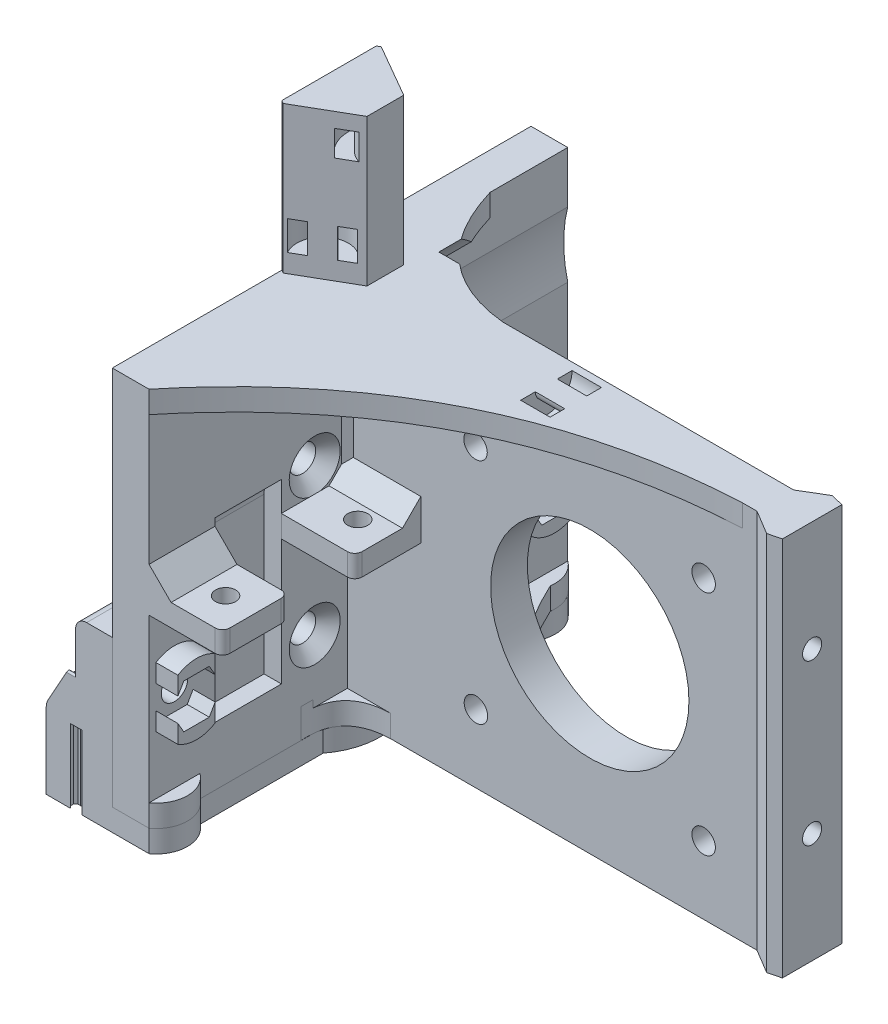
from build123d import *

# Parameters (mm, degrees)
CROQUIS1_W                                           = 41.764356623
CROQUIS1_H                                           = 43.764356531
CROQUIS1_R                                           = 13.5
CROQUIS1_R_2                                         = 1.6
SALIENTE_EXTRUIR1_DEPTH                              = 5
CROQUIS2_W                                           = 5
CROQUIS2_H                                           = 43.764356531
SALIENTE_EXTRUIR2_DEPTH                              = 17
CROQUIS3_W                                           = 5
CROQUIS3_H                                           = 43.764356531
SALIENTE_EXTRUIR3_DEPTH                              = 27
CROQUIS4_W                                           = 5
CROQUIS4_H                                           = 43.764356531
SALIENTE_EXTRUIR4_DEPTH                              = 25
SALIENTE_EXTRUIR5_DEPTH                              = 15.4
SALIENTE_EXTRUIR6_DEPTH                              = 1
SALIENTE_EXTRUIR7_START                              = 1
SALIENTE_EXTRUIR7_DEPTH                              = 3
CROQUIS6_R                                           = 1.6
CORTAR_EXTRUIR1_DEPTH                                = 8
CHAFL_N8_SIZE                                        = 1.5
AVELLANADO_PARA_TORNILLO_CON_CABEZA_AVEL_D           = 3.6
AVELLANADO_PARA_TORNILLO_CON_CABEZA_AVEL_CSINK_D     = 6.94
AVELLANADO_PARA_TORNILLO_CON_CABEZA_AVEL_CSINK_ANGLE = 90
CORTAR_EXTRUIR2_DEPTH                                = 63.345489181
CORTAR_EXTRUIR2_DEPTH_BACK                           = 5.5
CROQUIS10_R                                          = 18.000000066
SALIENTE_EXTRUIR8_DEPTH                              = 1
SALIENTE_EXTRUIR9_START                              = 1
SALIENTE_EXTRUIR9_DEPTH                              = 3
CORTAR_EXTRUIR3_START                                = -8
CROQUIS12_W                                          = 2.367549416
CROQUIS12_H                                          = 9.053736917
CORTAR_EXTRUIR3_DEPTH                                = 24.119517504
REDONDEO6_START                                      = 13
REDONDEO6_DEPTH                                      = 11
SALIENTE_EXTRUIR10_START                             = -25.119518
CROQUIS13_W                                          = 10
CROQUIS13_H                                          = 8.973153723
CROQUIS13_H_2                                        = 9
SALIENTE_EXTRUIR10_DEPTH                             = 3
CORTAR_EXTRUIR4_REACH                                = 58.373
CROQUIS17_R                                          = 1.375
SALIENTE_EXTRUIR13_DEPTH                             = 7
SALIENTE_EXTRUIR15_DEPTH                             = 51.764356531
CROQUIS21_R                                          = 1.3
CORTAR_EXTRUIR5_DEPTH                                = 7
CHAFL_N2_SIZE                                        = 2
CHAFL_N2_SIZE2                                       = 1.457737974
CHAFL_N3_SIZE                                        = 2
CHAFL_N3_SIZE2                                       = 1.457737974
CHAFL_N4_SIZE                                        = 3
REDONDEO7_R                                          = 1
SALIENTE_EXTRUIR16_START                             = -5
CROQUIS25_R                                          = 4.8
SALIENTE_EXTRUIR16_DEPTH                             = 3
CROQUIS25_3_R                                        = 1.65
CORTAR_EXTRUIR7_DEPTH                                = 5
SALIENTE_EXTRUIR17_START                             = 9
CROQUIS26_R                                          = 1.65
SALIENTE_EXTRUIR17_DEPTH                             = 9
CROQUIS31_W                                          = 2
CROQUIS31_H                                          = 4
CROQUIS32_W                                          = 4
CROQUIS32_H                                          = 2
SALIENTE_EXTRUIR18_DEPTH                             = 20
CHAFL_N5_SIZE                                        = 5
CROQUIS34_W                                          = 2
CROQUIS34_H                                          = 3.5
CROQUIS37_W                                          = 2
CROQUIS37_H                                          = 4
CROQUIS35_W                                          = 2
CROQUIS35_H                                          = 3.5
CHAFL_N6_SIZE                                        = 0.5
CHAFL_N7_SIZE                                        = 0.5
CORTAR_EXTRUIR8_DEPTH                                = 7
CROQUIS38_W                                          = 9.4
CROQUIS38_H                                          = 5
CROQUIS38_W_2                                        = 12.5
CORTAR_EXTRUIR9_DEPTH                                = 4
CORTAR_EXTRUIR11_DEPTH                               = 88.561407089
REDONDEO8_START                                      = -26
REDONDEO8_DEPTH                                      = 59
AVELLANADO_PARA_TORNILLO_CON_CABEZA_2_AT_COUNT       = 2
AVELLANADO_PARA_TORNILLO_CON_CABEZA_2_AT_PITCH       = 48.735898385
CROQUIS42_R                                          = 3.75
CORTAR_EXTRUIR12_DEPTH                               = 4
REDONDEO9_R                                          = 0.2
REDONDEO10_R                                         = 2
REDONDEO11_R                                         = 2
CHAFL_N9_SIZE                                        = 0.8
CHAFL_N10_SIZE                                       = 2.5
SALIENTE_EXTRUIR19_OUTLINE_R                         = 1.65
SALIENTE_EXTRUIR19_DEPTH                             = 3
SALIENTE_EXTRUIR20_DEPTH                             = 3
CORTAR_EXTRUIR13_DEPTH                               = 3
CORTAR_EXTRUIR13_DEPTH_BACK                          = 2
CROQUIS45_3_R                                        = 1.375
REDONDEO12_R                                         = 1.5
REDONDEO13_R                                         = 1.5


with BuildPart() as part:
    # Croquis1 → Saliente-Extruir1 (new body)
    with BuildSketch(Plane.XY):
        with Locations((-0.117821688, 1.117821734)):
            Rectangle(CROQUIS1_W, CROQUIS1_H)
        Circle(CROQUIS1_R, mode=Mode.SUBTRACT)
        with Locations((-15.556349186, 15.556349186)):
            Circle(CROQUIS1_R_2, mode=Mode.SUBTRACT)
        with Locations((15.5, 15.5)):
            Circle(CROQUIS1_R_2, mode=Mode.SUBTRACT)
        with Locations((15.5, -15.5)):
            Circle(CROQUIS1_R_2, mode=Mode.SUBTRACT)
        with Locations((-15.5, -15.5)):
            Circle(CROQUIS1_R_2, mode=Mode.SUBTRACT)
    extrude(amount=SALIENTE_EXTRUIR1_DEPTH)

    # Croquis2 → Saliente-Extruir2 (add)
    with BuildSketch(Plane.ZY.offset(21)):
        with Locations((2.5, 1.117821734)):
            Rectangle(CROQUIS2_W, CROQUIS2_H)
    extrude(amount=SALIENTE_EXTRUIR2_DEPTH)

    # Croquis3 → Saliente-Extruir3 (add)
    with BuildSketch(Plane.XY.offset(5)):
        with Locations((-35.5, 1.117821734)):
            Rectangle(CROQUIS3_W, CROQUIS3_H)
    extrude(amount=SALIENTE_EXTRUIR3_DEPTH)

    # Croquis4 → Saliente-Extruir4 (add)
    with BuildSketch(Plane(origin=(0, 0, 0), x_dir=(-1, 0, 0), z_dir=(0, 0, -1))):
        with Locations((35.5, 1.117821734)):
            Rectangle(CROQUIS4_W, CROQUIS4_H)
    extrude(amount=SALIENTE_EXTRUIR4_DEPTH)

    # Croquis4<6> → Saliente-Extruir5 (add)
    with BuildSketch(Plane(origin=(0, 0, 0), x_dir=(-1, 0, 0), z_dir=(0, 0, -1))):
        Polygon((33, 0.431528762), (38, 5.790226637), (38, 23), (33, 23), align=None)
    extrude(amount=SALIENTE_EXTRUIR5_DEPTH)

    # Croquis5 → Saliente-Extruir6 (add)
    with BuildSketch(Plane(origin=(0, 23, 0), x_dir=(1, 0, 0), z_dir=(0, 1, 0))):
        Polygon((-33, 25), (-38, 25), (-38, -32), (-33, -32), (-33, -5), (20.764356623, -5), (20.764356623, 0), (-33, 0), align=None)
    extrude(amount=SALIENTE_EXTRUIR6_DEPTH)

    # Croquis5<3> → Saliente-Extruir7 (add)
    with BuildSketch(Plane(origin=(0, 23, 0), x_dir=(1, 0, 0), z_dir=(0, 1, 0)).offset(SALIENTE_EXTRUIR7_START)):
        Polygon((20.764356623, -5), (20.764356623, 0), (-16.86119396, 0), (-33, 0), (-33, 14.427372244), (-33, 25), (-38, 25), (-38, -32), (-33, -32), (-33, -5), align=None)
        with BuildLine():
            Line((-33, 0), (-16.86119396, 0))
            add(Edge.make_bspline(
                [(-33, 14.427372244), (-29.074886611, 1.247382474), (-16.86119396, 0)],
                knots=[0.035029733, 0.035029733, 0.035029733, 1, 1, 1], degree=2))
            Line((-33, 14.427372244), (-33, 0))
        make_face()
        with BuildLine():
            add(Edge.make_bspline(
                [(20.764356623, -5), (-12.279495677, -6.588334272), (-33, -32)],
                knots=[0, 0, 0, 1, 1, 1], degree=2))
            Line((20.764356623, -5), (-33, -5))
            Line((-33, -5), (-33, -32))
        make_face()
    extrude(amount=SALIENTE_EXTRUIR7_DEPTH)

    # Croquis6 → Cortar-Extruir1 (cut)
    with BuildSketch(Plane.ZY.offset(38)):
        with Locations((-5.55, 6.735643469)):
            Circle(CROQUIS6_R)
        with Locations((9.449986467, 6.735643469)):
            Circle(CROQUIS6_R)
        with Locations((9.449986467, -13.264356531)):
            Circle(CROQUIS6_R)
        with Locations((-5.55, -13.264356531)):
            Circle(CROQUIS6_R)
    extrude(amount=-CORTAR_EXTRUIR1_DEPTH, mode=Mode.SUBTRACT)

    # Chaflán8
    chafl_n8_edges = [part.edges().sort_by_distance(p)[0] for p in [
        (-33, 1.617821734, 0),
    ]]
    chamfer(chafl_n8_edges, length=CHAFL_N8_SIZE)

    # Avellanado para tornillo con cabeza avel (through all)
    with Locations(Plane(origin=(-33, 0, 0), x_dir=(0, 0, -1), z_dir=(1, 0, 0))):
        with Locations((-9.449986467, 6.735643469), (-9.449986467, -13.264356531), (5.55, 6.735643469), (5.55, -13.264356531)):
            CounterSinkHole(AVELLANADO_PARA_TORNILLO_CON_CABEZA_AVEL_D / 2, AVELLANADO_PARA_TORNILLO_CON_CABEZA_AVEL_CSINK_D / 2, counter_sink_angle=AVELLANADO_PARA_TORNILLO_CON_CABEZA_AVEL_CSINK_ANGLE)

    # Croquis10 → Cortar-Extruir2 (cut, two sides: drawn at the far end of the back side and taken through both)
    with BuildSketch(Plane(origin=(0, 0, -9.4), x_dir=(-1, 0, 0), z_dir=(0, 0, -1)).offset(-CORTAR_EXTRUIR2_DEPTH_BACK)):
        with Locations((15.556349116, 15.556349186)):
            Circle(CROQUIS10_R)
    extrude(amount=CORTAR_EXTRUIR2_DEPTH + CORTAR_EXTRUIR2_DEPTH_BACK, mode=Mode.SUBTRACT)

    # Croquis11 → Saliente-Extruir8 (add)
    with BuildSketch(Plane.XZ.offset(20.764356531)):
        with BuildLine():
            Line((-33, 32), (-38, 32))
            Line((-38, 32), (-38, -25))
            Line((-38, -25), (-33, -25))
            Line((-33, -25), (-33, -1.5))
            Line((-33, -1.5), (-31.5, 0))
            Line((-31.5, 0), (20.764356623, 0))
            Line((20.764356623, 0), (20.764356623, 5))
            Line((20.764356623, 5), (-27.115659371, 5))
            Line((-27.115659371, 5), (-33, 5))
            Line((-33, 5), (-33, 9.68062156))
            add(Edge.make_bspline(
                [(-33, 9.68062156), (-33.068392113, 10.426509896), (-33, 11.291135269)],
                knots=[0.858715729, 0.858715729, 0.858715729, 1, 1, 1], degree=2))
            Line((-33, 11.291135269), (-33, 32))
        make_face()
    extrude(amount=SALIENTE_EXTRUIR8_DEPTH)

    # Croquis11<3> → Saliente-Extruir9 (add)
    with BuildSketch(Plane.XZ.offset(20.764356531).offset(SALIENTE_EXTRUIR9_START)):
        with BuildLine():
            Line((-33, 32), (-38, 32))
            Line((-38, 32), (-38, -25))
            Line((-38, -25), (-33, -25))
            Line((-33, -25), (-33, -1.5))
            Line((-33, -1.5), (-31.5, 0))
            Line((-31.5, 0), (20.764356623, 0))
            Line((20.764356623, 0), (20.764356623, 5))
            Line((20.764356623, 5), (-27.115659371, 5))
            Line((-27.115659371, 5), (-33, 5))
            Line((-33, 5), (-33, 9.68062156))
            add(Edge.make_bspline(
                [(-33, 9.68062156), (-33.068392113, 10.426509896), (-33, 11.291135269)],
                knots=[0.858715729, 0.858715729, 0.858715729, 1, 1, 1], degree=2))
            Line((-33, 11.291135269), (-33, 32))
        make_face()
        with BuildLine():
            Line((-33, -1.5), (-33, -25))
            add(Edge.make_bspline(
                [(20.764356623, 0), (-4.014762231, -1.697794621), (-22.436254985, 2.729649491), (-33, -25)],
                knots=[0, 0, 0, 0, 1, 1, 1, 1], degree=3))
            Line((20.764356623, 0), (-31.5, 0))
            Line((-31.5, 0), (-33, -1.5))
        make_face()
        with BuildLine():
            add(Edge.make_bspline(
                [(-27.115659371, 5), (-32.584317612, 5.147165418), (-33, 9.68062156)],
                knots=[0, 0, 0, 0.858715729, 0.858715729, 0.858715729], degree=2))
            Line((-33, 9.68062156), (-33, 5))
            Line((-33, 5), (-27.115659371, 5))
        make_face()
    extrude(amount=SALIENTE_EXTRUIR9_DEPTH)

    # Croquis12 → Cortar-Extruir3 (cut)
    with BuildSketch(Plane.XZ.offset(24.764356531).offset(CORTAR_EXTRUIR3_START)):
        with Locations((-34.183774708, 18.499977818)):
            Rectangle(CROQUIS12_W, CROQUIS12_H)
    extrude(amount=-CORTAR_EXTRUIR3_DEPTH, mode=Mode.SUBTRACT)

    # Redondeo6: read off the stored shape, not the designer's step
    # Redondeo6 outline → Redondeo6 (add)
    with BuildSketch(Plane.XY.offset(REDONDEO6_START)):
        with BuildLine():
            Line((-35.367549416, 7.355160973), (-35.367549416, 4.422584246))
            add(Edge.make_bspline(
                [(-35.367549416, 4.422584246), (-35.367549416, 6.844566315), (-33, 7.355160973)],
                knots=[0, 0, 0, 1, 1, 1], degree=2))
            Line((-33, 7.355160973), (-35.367549416, 7.355160973))
        make_face()
    extrude(amount=REDONDEO6_DEPTH)

    # Croquis13 → Saliente-Extruir10 (add)
    with BuildSketch(Plane.XZ.offset(24.764356531).offset(SALIENTE_EXTRUIR10_START)):
        with Locations((-28, 27.513423139)):
            Rectangle(CROQUIS13_W, CROQUIS13_H)
        with Locations((-28, 9.5)):
            Rectangle(CROQUIS13_W, CROQUIS13_H_2)
    extrude(amount=-SALIENTE_EXTRUIR10_DEPTH)

    # Croquis17 → Cortar-Extruir4 (cut, up to next)
    with BuildSketch(Plane.XZ.offset(-0.355160973), mode=Mode.PRIVATE) as cortar_extruir4_sk1:
        with Locations((-27.082705683, 27.500122938)):
            Circle(CROQUIS17_R)
    cortar_extruir4_tool1 = extrude(cortar_extruir4_sk1.sketch, amount=-CORTAR_EXTRUIR4_REACH, mode=Mode.PRIVATE) & part.part
    # Croquis17 → Cortar-Extruir4 (cut, up to next)
    with BuildSketch(Plane.XZ.offset(-0.355160973), mode=Mode.PRIVATE) as cortar_extruir4_sk2:
        with Locations((-27.084390941, 9.502004367)):
            Circle(CROQUIS17_R)
    cortar_extruir4_tool2 = extrude(cortar_extruir4_sk2.sketch, amount=-CORTAR_EXTRUIR4_REACH, mode=Mode.PRIVATE) & part.part
    add(cortar_extruir4_tool1.solids().sort_by_distance((-27.082706, 0.355161, 27.500123))[0], mode=Mode.SUBTRACT)
    add(cortar_extruir4_tool2.solids().sort_by_distance((-27.084391, 0.355161, 9.502004))[0], mode=Mode.SUBTRACT)

    # Croquis18 → Saliente-Extruir13 (add)
    with BuildSketch(Plane(origin=(20.764356623, 0, 0), x_dir=(0, 0, -1), z_dir=(1, 0, 0))):
        Polygon((0, -21.764356531), (0, 27), (-5, 27), (-5, 24), (-5, -24.764356531), (0, -24.764356531), align=None)
    extrude(amount=SALIENTE_EXTRUIR13_DEPTH)

    # Croquis20 → Saliente-Extruir15 (add)
    with BuildSketch(Plane(origin=(0, 27, 0), x_dir=(1, 0, 0), z_dir=(0, 1, 0))):
        Polygon((27.764356623, -5), (22.764356623, -5), (27.764356623, -8), align=None)
    saliente_extruir15 = extrude(amount=-SALIENTE_EXTRUIR15_DEPTH)

    # Simetría1: Saliente-Extruir15 across plane
    add(saliente_extruir15.mirror(Plane(origin=(0, 0, 2.5), x_dir=(1, 0, 0), z_dir=(0, 0, -1))))

    # Croquis21 → Cortar-Extruir5 (cut)
    with BuildSketch(Plane(origin=(27.764356623, 0, 0), x_dir=(0, 0, -1), z_dir=(1, 0, 0))):
        with Locations((-2.5, 12)):
            Circle(CROQUIS21_R)
        with Locations((-2.5, -9.764356531)):
            Circle(CROQUIS21_R)
    extrude(amount=-CORTAR_EXTRUIR5_DEPTH, mode=Mode.SUBTRACT)

    # Chaflán2
    chafl_n2_edges = [part.edges().sort_by_distance(p)[0] for p in [
        (27.764356623, 1.117821735, 8),
    ]]
    chafl_n2_side = [part.faces().sort_by_distance(p)[0] for p in [
        (25.264356623, 1.117821735, 6.5),
    ]]
    chamfer(chafl_n2_edges, length=CHAFL_N2_SIZE, length2=CHAFL_N2_SIZE2, reference=chafl_n2_side[0])

    # Chaflán3
    chafl_n3_edges = [part.edges().sort_by_distance(p)[0] for p in [
        (27.764356623, 1.117821735, -3),
    ]]
    chafl_n3_side = [part.faces().sort_by_distance(p)[0] for p in [
        (25.264356623, 1.117821735, -1.5),
    ]]
    chamfer(chafl_n3_edges, length=CHAFL_N3_SIZE, length2=CHAFL_N3_SIZE2, reference=chafl_n3_side[0])

    # Chaflán4
    chafl_n4_edges = [part.edges().sort_by_distance(p)[0] for p in [
        (-33, 3.355161469, 27.513423139),
    ]]
    chamfer(chafl_n4_edges, length=CHAFL_N4_SIZE)

    # Redondeo7
    redondeo7_edges = [part.edges().sort_by_distance(p)[0] for p in [
        (-23, 1.855161469, 23.026846277),
        (-23, 1.855161469, 32),
        (-23, 1.855161469, 14),
    ]]
    fillet(redondeo7_edges, radius=REDONDEO7_R)

    # Croquis25 → Saliente-Extruir16 (add)
    # profile 1 of 3: a face of its own
    with BuildSketch(Plane.ZY.offset(38).offset(SALIENTE_EXTRUIR16_START)):
        with Locations((-20.2, -9.764356531)):
            Circle(CROQUIS25_R)
        Polygon((-18.467949192, -12.764356531), (-16.735898385, -9.764356531), (-18.467949192, -6.764356531), (-21.932050808, -6.764356531), (-23.664101615, -9.764356531), (-21.932050808, -12.764356531), align=None, mode=Mode.SUBTRACT)
    # profile 2 of 3: a face of its own
    with BuildSketch(Plane.ZY.offset(38).offset(SALIENTE_EXTRUIR16_START)):
        with BuildLine():
            Line((31.067949192, -13.842189131), (31.067949192, -11.378715885))
            Line((31.067949192, -11.378715885), (30.267949192, -12.764356531))
            Line((30.267949192, -12.764356531), (26.803847577, -12.764356531))
            Line((26.803847577, -12.764356531), (26.003847577, -11.378715885))
            Line((26.003847577, -11.378715885), (26.003847577, -13.842189131))
            ThreePointArc((26.003847577, -13.842189131), (28.535898385, -14.564356531), (31.067949192, -13.842189131))
        make_face()
    # profile 3 of 3: a face of its own
    with BuildSketch(Plane.ZY.offset(38).offset(SALIENTE_EXTRUIR16_START)):
        with BuildLine():
            Line((30.267949192, -6.764356531), (31.067949192, -8.149997177))
            Line((31.067949192, -8.149997177), (31.067949192, -5.686523932))
            ThreePointArc((31.067949192, -5.686523932), (28.535898385, -4.964356531), (26.003847577, -5.686523932))
            Line((26.003847577, -5.686523932), (26.003847577, -8.149997177))
            Line((26.003847577, -8.149997177), (26.803847577, -6.764356531))
            Line((26.803847577, -6.764356531), (30.267949192, -6.764356531))
        make_face()
    extrude(amount=-SALIENTE_EXTRUIR16_DEPTH)

    # Croquis25<3> → Cortar-Extruir7 (cut)
    with BuildSketch(Plane.ZY.offset(38)):
        with Locations(Location((28.535898385, -9.764356531, 0), (0, 0, 270))):
            Circle(CROQUIS25_3_R)
        with Locations(Location((-20.2, -9.764356531, 0), (0, 0, 270))):
            Circle(CROQUIS25_3_R)
    extrude(amount=-CORTAR_EXTRUIR7_DEPTH, mode=Mode.SUBTRACT)

    # Croquis26 → Saliente-Extruir17 (add)
    with BuildSketch(Plane.ZY.offset(38).offset(SALIENTE_EXTRUIR17_START)):
        Polygon((-25, -4.764356531), (-25, -24.764356531), (32, -24.764356531), (32, -4.764356531), (19.5, -4.764356531), (19.5, -16.964356531), (-15.6, -16.964356531), (-15.6, -4.764356531), align=None)
        with Locations(Location((-20.2, -9.764356531, 0), (0, 0, 270))):
            Circle(CROQUIS26_R, mode=Mode.SUBTRACT)
        with Locations(Location((28.535898385, -9.764356531, 0), (0, 0, 270))):
            Circle(CROQUIS26_R, mode=Mode.SUBTRACT)
    extrude(amount=-SALIENTE_EXTRUIR17_DEPTH)

    # Croquis31 → Cortar-Revolución1 (revolve, cut)
    with BuildSketch(Plane(origin=(0, 0, -25), x_dir=(-1, 0, 0), z_dir=(0, 0, -1))):
        with Locations((35.5, 3.298370034)):
            Rectangle(CROQUIS31_W, CROQUIS31_H)
        with Locations((35.5, 23.298370034)):
            Rectangle(CROQUIS31_W, CROQUIS31_H)
    revolve(axis=Axis((-38, -24.764356531, -25), (0, 1, 0)), mode=Mode.SUBTRACT)

    # Croquis32 → Cortar-Revolución2 (revolve, cut)
    with BuildSketch(Plane(origin=(0, 27, 0), x_dir=(1, 0, 0), z_dir=(0, 1, 0))):
        with Locations((-4.40795048, -2.005416007)):
            Rectangle(CROQUIS32_W, CROQUIS32_H)
    revolve(axis=Axis((5.078126089, 27, 4.505416007), (-1, 0, 0)), mode=Mode.SUBTRACT)

    # Croquis33 → Saliente-Extruir18 (add)
    with BuildSketch(Plane(origin=(0, 27, 0), x_dir=(1, 0, 0), z_dir=(0, 1, 0))):
        Polygon((-26, -2.5), (-38, 4.42820323), (-38, -9.42820323), align=None)
    extrude(amount=SALIENTE_EXTRUIR18_DEPTH)

    # Chaflán5
    chafl_n5_edges = [part.edges().sort_by_distance(p)[0] for p in [
        (-26, 37, 2.5),
    ]]
    chamfer(chafl_n5_edges, length=CHAFL_N5_SIZE)

    # Croquis34 → Cortar-Revolución3 (revolve, cut)
    with BuildSketch(Plane(origin=(-7.582531755, 0, 13.133330249), x_dir=(-0.8660254037844386, 0, -0.4999999999999999), z_dir=(0.49999999999999994, 0, -0.8660254037844387))):
        with Locations((28.194863729, 31.25)):
            Rectangle(CROQUIS34_W, CROQUIS34_H)
    revolve(axis=Axis((-34.165063509, 47, -2.214101615), (0, -1, 0)), mode=Mode.SUBTRACT)

    # Croquis37 → Cortar-Revolución4 (revolve, cut)
    with BuildSketch(Plane(origin=(-5.417468245, 0, -9.383330249), x_dir=(0.8660254037844386, 0, -0.5000000000000003), z_dir=(0.5000000000000002, 0, 0.8660254037844385))):
        with Locations((-30.694863729, 31.5)):
            Rectangle(CROQUIS37_W, CROQUIS37_H)
    revolve(axis=Axis((-34.165063509, 47, 7.214101615), (0, -1, 0)), mode=Mode.SUBTRACT)

    # Croquis35 → Cortar-Revolución5 (revolve, cut)
    with BuildSketch(Plane(origin=(-30.330127019, 0, 0), x_dir=(0, 0, -1), z_dir=(1, 0, 0))):
        with Locations((1.464101615, 43.25)):
            Rectangle(CROQUIS35_W, CROQUIS35_H)
    revolve(axis=Axis((-30.330127019, 47, 2.5), (0, -1, 0)), mode=Mode.SUBTRACT)

    # Chaflán6
    chafl_n6_edges = [part.edges().sort_by_distance(p)[0] for p in [
        (-38, 37, 9.42820323),
    ]]
    chamfer(chafl_n6_edges, length=CHAFL_N6_SIZE)

    # Chaflán7
    chafl_n7_edges = [part.edges().sort_by_distance(p)[0] for p in [
        (-38, 37, -4.42820323),
    ]]
    chamfer(chafl_n7_edges, length=CHAFL_N7_SIZE)

    # Croquis29 → Cortar-Extruir8 (cut)
    with BuildSketch(Plane.XZ.offset(24.764356531)):
        Polygon((-43.5, 32), (-43.7, 32), (-44, 31.7), (-44, 31.3), (-43.7, 31), (-43.3, 31), (-43, 30.7), (-43, 30.3), (-43.3, 30), (-43.5, 30), (-43.7, 30), (-44, 29.7), (-44, 29.3), (-43.7, 29), (-43.3, 29), (-43, 28.7), (-43, 28.3), (-43.3, 28), (-43.5, 28), (-43.7, 28), (-44, 27.7), (-44, 27.3), (-43.7, 27), (-43.3, 27), (-43, 26.7), (-43, 26.3), (-43.3, 26), (-43.5, 26), (-43.7, 26), (-44, 25.7), (-44, 25.3), (-43.7, 25), (-43.3, 25), (-43, 24.7), (-43, 24.3), (-43.3, 24), (-43.5, 24), (-43.7, 24), (-44, 23.7), (-44, 23.3), (-43.7, 23), (-43.3, 23), (-43, 22.7), (-43, 22.3), (-43.3, 22), (-43.5, 22), (-43.7, 22), (-44, 21.7), (-44, 21.3), (-43.7, 21), (-43.3, 21), (-43, 20.7), (-43, 20.3), (-43.3, 20), (-43.5, 20), (-43.7, 20), (-44, 19.7), (-44, 19.3), (-43.7, 19), (-43.3, 19), (-43, 18.7), (-43, 18.3), (-43.3, 18), (-43.5, 18), (-43.7, 18), (-44, 17.7), (-44, 17.3), (-43.7, 17), (-43.3, 17), (-43, 16.7), (-43, 16.3), (-43.3, 16), (-43.5, 16), (-43.7, 16), (-44, 15.7), (-44, 15.3), (-43.7, 15), (-43.3, 15), (-43, 14.7), (-43, 14.3), (-43.3, 14), (-43.5, 14), (-43.7, 14), (-44, 13.7), (-44, 13.3), (-43.7, 13), (-43.3, 13), (-43, 12.7), (-43, 12.3), (-43.3, 12), (-43.5, 12), (-43.7, 12), (-44, 11.7), (-44, 11.3), (-43.7, 11), (-43.3, 11), (-43, 10.7), (-43, 10.3), (-43.3, 10), (-43.5, 10), (-43.7, 10), (-44, 9.7), (-44, 9.3), (-43.7, 9), (-43.3, 9), (-43, 8.7), (-43, 8.3), (-43.3, 8), (-43.5, 8), (-43.7, 8), (-44, 7.7), (-44, 7.3), (-43.7, 7), (-43.3, 7), (-43, 6.7), (-43, 6.3), (-43.3, 6), (-43.5, 6), (-43.7, 6), (-44, 5.7), (-44, 5.3), (-43.7, 5), (-43.3, 5), (-43, 4.7), (-43, 4.3), (-43.3, 4), (-43.5, 4), (-43.7, 4), (-44, 3.7), (-44, 3.3), (-43.7, 3), (-43.3, 3), (-43, 2.7), (-43, 2.3), (-43.3, 2), (-43.5, 2), (-43.7, 2), (-44, 1.7), (-44, 1.3), (-43.7, 1), (-43.3, 1), (-43, 0.7), (-43, 0.3), (-43.3, 0), (-43.5, 0), (-43.7, 0), (-44, -0.3), (-44, -0.7), (-43.7, -1), (-43.3, -1), (-43, -1.3), (-43, -1.7), (-43.3, -2), (-43.5, -2), (-43.7, -2), (-44, -2.3), (-44, -2.7), (-43.7, -3), (-43.3, -3), (-43, -3.3), (-43, -3.7), (-43.3, -4), (-43.5, -4), (-43.7, -4), (-44, -4.3), (-44, -4.7), (-43.7, -5), (-43.3, -5), (-43, -5.3), (-43, -5.7), (-43.3, -6), (-43.5, -6), (-43.7, -6), (-44, -6.3), (-44, -6.7), (-43.7, -7), (-43.3, -7), (-43, -7.3), (-43, -7.7), (-43.3, -8), (-43.5, -8), (-43.7, -8), (-44, -8.3), (-44, -8.7), (-43.7, -9), (-43.3, -9), (-43, -9.3), (-43, -9.7), (-43.3, -10), (-43.5, -10), (-43.7, -10), (-44, -10.3), (-44, -10.7), (-43.7, -11), (-43.3, -11), (-43, -11.3), (-43, -11.7), (-43.3, -12), (-43.5, -12), (-43.7, -12), (-44, -12.3), (-44, -12.7), (-43.7, -13), (-43.3, -13), (-43, -13.3), (-43, -13.7), (-43.3, -14), (-43.5, -14), (-43.7, -14), (-44, -14.3), (-44, -14.7), (-43.7, -15), (-43.3, -15), (-43, -15.3), (-43, -15.7), (-43.3, -16), (-43.5, -16), (-43.7, -16), (-44, -16.3), (-44, -16.7), (-43.7, -17), (-43.3, -17), (-43, -17.3), (-43, -17.7), (-43.3, -18), (-43.5, -18), (-43.7, -18), (-44, -18.3), (-44, -18.7), (-43.7, -19), (-43.3, -19), (-43, -19.3), (-43, -19.7), (-43.3, -20), (-43.5, -20), (-43.7, -20), (-44, -20.3), (-44, -20.7), (-43.7, -21), (-43.3, -21), (-43, -21.3), (-43, -21.7), (-43.3, -22), (-43.5, -22), (-43.7, -22), (-44, -22.3), (-44, -22.7), (-43.7, -23), (-43.3, -23), (-43, -23.3), (-43, -23.7), (-43.3, -24), (-43.5, -24), (-43.7, -24), (-44, -24.3), (-44, -24.7), (-43.7, -25), (-43.3, -25), (-42.1, -25), (-42.1, 32), align=None)
    extrude(amount=-CORTAR_EXTRUIR8_DEPTH, mode=Mode.SUBTRACT)

    # Croquis38 → Cortar-Extruir9 (cut)
    with BuildSketch(Plane.ZY.offset(47)):
        with Locations((-20.3, -7.264356531)):
            Rectangle(CROQUIS38_W, CROQUIS38_H)
        with Locations((25.75, -7.264356531)):
            Rectangle(CROQUIS38_W_2, CROQUIS38_H)
    extrude(amount=-CORTAR_EXTRUIR9_DEPTH, mode=Mode.SUBTRACT)

    # Croquis39 → Cortar-Extruir11 (cut, through all)
    with BuildSketch(Plane(origin=(0, 0, -25), x_dir=(-1, 0, 0), z_dir=(0, 0, -1))):
        Polygon((47, -16.964356531), (47, -9.764356531), (43, -9.764356531), align=None)
    extrude(amount=-CORTAR_EXTRUIR11_DEPTH, mode=Mode.SUBTRACT)

    # Redondeo8: read off the stored shape, not the designer's step
    # Redondeo8 outline → Redondeo8 (cut)
    with BuildSketch(Plane.XY.offset(REDONDEO8_START)):
        with BuildLine():
            Line((-46.748314552, -16.511322725), (-47, -16.964356531))
            Line((-47, -16.964356531), (-47, -17.482608588))
            ThreePointArc((-47, -17.482608588), (-46.936056443, -16.980925971), (-46.748314552, -16.511322725))
        make_face()
    extrude(amount=REDONDEO8_DEPTH, mode=Mode.SUBTRACT)

    # Croquis41 → Avellanado para tornillo con cabeza  2 (revolve, cut)
    with BuildSketch(Plane(origin=(-43, -9.764356531, -20.2), x_dir=(0, 0, 1), z_dir=(0, 1, 0))):
        Polygon((0, 0), (0, 70.764356623), (1.8, 70.764356623), (1.8, 1.67), (3.47, 0), align=None)
    avellanado_para_tornillo_con_cabeza_2 = revolve(axis=Axis((-49.35, -9.764356531, -20.2), (1, 0, 0)), mode=Mode.SUBTRACT)

    # Avellanado para tornillo con cabeza 2 at: Avellanado para tornillo con cabeza  2 ×2
    with Locations(*[(0, 0, i * AVELLANADO_PARA_TORNILLO_CON_CABEZA_2_AT_PITCH) for i in range(1, AVELLANADO_PARA_TORNILLO_CON_CABEZA_2_AT_COUNT)]):
        add(avellanado_para_tornillo_con_cabeza_2, mode=Mode.SUBTRACT)

    # Croquis42 → Cortar-Extruir12 (cut)
    with BuildSketch(Plane.ZY.offset(43)):
        with Locations((-20.2, -9.764356531)):
            Circle(CROQUIS42_R)
        with Locations((28.535898385, -9.764356531)):
            Circle(CROQUIS42_R)
    extrude(amount=CORTAR_EXTRUIR12_DEPTH, mode=Mode.SUBTRACT)

    # Redondeo9
    redondeo9_edges = [part.edges().sort_by_distance(p)[0] for p in [
        (-43.398927962, -11.200497193, 32),
    ]]
    fillet(redondeo9_edges, radius=REDONDEO9_R)

    # Redondeo10
    redondeo10_edges = [part.edges().sort_by_distance(p)[0] for p in [
        (-43, -9.764356531, 22.142949192),
    ]]
    fillet(redondeo10_edges, radius=REDONDEO10_R)

    # Redondeo11
    redondeo11_edges = [part.edges().sort_by_distance(p)[0] for p in [
        (-43, -9.764356531, -24.475),
        (-43, -9.764356531, -16.025),
    ]]
    fillet(redondeo11_edges, radius=REDONDEO11_R)

    # Chaflán9
    chafl_n9_edges = [part.edges().sort_by_distance(p)[0] for p in [
        (-33, 13.677580734, 5),
    ]]
    chamfer(chafl_n9_edges, length=CHAFL_N9_SIZE)

    # Chaflán10
    chafl_n10_edges = [part.edges().sort_by_distance(p)[0] for p in [
        (-27.6, 3.355161469, 5),
    ]]
    chamfer(chafl_n10_edges, length=CHAFL_N10_SIZE)


with BuildPart() as body_2:
    # Partir1: read off the stored shape, not the designer's step
    # Partir1: the piece on the far side of the plane
    add(part.part)
    split(bisect_by=Plane.YZ.offset(-38), keep=Keep.BOTTOM)

    # Saliente-Extruir19: read off the stored shape, not the designer's step
    # Saliente-Extruir19 outline → Saliente-Extruir19 (add)
    # profile 1 of 2: a face of its own
    with BuildSketch(Plane.XZ.offset(24.764356531)):
        Polygon((-44, -24.3), (-43.7, -24), (-43.3, -24), (-43, -23.7), (-43, -23.3), (-43.3, -23), (-43.7, -23), (-44, -22.7), (-44, -22.3), (-43.7, -22), (-43.3, -22), (-43, -21.7), (-43, -21.3), (-43.3, -21), (-43.7, -21), (-44, -20.7), (-44, -20.3), (-43.7, -20), (-43.3, -20), (-43, -19.7), (-43, -19.3), (-43.3, -19), (-43.7, -19), (-44, -18.7), (-44, -18.3), (-43.7, -18), (-43.3, -18), (-43, -17.7), (-43, -17.3), (-43.3, -17), (-43.7, -17), (-44, -16.7), (-44, -16.3), (-43.7, -16), (-43.3, -16), (-43, -15.7), (-43, -15.3), (-43.3, -15), (-43.7, -15), (-44, -14.7), (-44, -14.3), (-43.7, -14), (-43.3, -14), (-43, -13.7), (-43, -13.3), (-43.3, -13), (-43.7, -13), (-44, -12.7), (-44, -12.3), (-43.7, -12), (-43.3, -12), (-43, -11.7), (-43, -11.3), (-43.3, -11), (-43.7, -11), (-44, -10.7), (-44, -10.3), (-43.7, -10), (-43.3, -10), (-43, -9.7), (-43, -9.3), (-43.3, -9), (-43.7, -9), (-44, -8.7), (-44, -8.3), (-43.7, -8), (-43.3, -8), (-43, -7.7), (-43, -7.3), (-43.3, -7), (-43.7, -7), (-44, -6.7), (-44, -6.3), (-43.7, -6), (-43.3, -6), (-43, -5.7), (-43, -5.3), (-43.3, -5), (-43.7, -5), (-44, -4.7), (-44, -4.3), (-43.7, -4), (-43.3, -4), (-43, -3.7), (-43, -3.3), (-43.3, -3), (-43.7, -3), (-44, -2.7), (-44, -2.3), (-43.7, -2), (-43.3, -2), (-43, -1.7), (-43, -1.3), (-43.3, -1), (-43.7, -1), (-44, -0.7), (-44, -0.3), (-43.7, 0), (-43.3, 0), (-43, 0.3), (-43, 0.7), (-43.3, 1), (-43.7, 1), (-44, 1.3), (-44, 1.7), (-43.7, 2), (-43.3, 2), (-43, 2.3), (-43, 2.7), (-43.3, 3), (-43.7, 3), (-44, 3.3), (-44, 3.7), (-43.7, 4), (-43.3, 4), (-43, 4.3), (-43, 4.7), (-43.3, 5), (-43.7, 5), (-44, 5.3), (-44, 5.7), (-43.7, 6), (-43.3, 6), (-43, 6.3), (-43, 6.7), (-43.3, 7), (-43.7, 7), (-44, 7.3), (-44, 7.7), (-43.7, 8), (-43.3, 8), (-43, 8.3), (-43, 8.7), (-43.3, 9), (-43.7, 9), (-44, 9.3), (-44, 9.7), (-43.7, 10), (-43.3, 10), (-43, 10.3), (-43, 10.7), (-43.3, 11), (-43.7, 11), (-44, 11.3), (-44, 11.7), (-43.7, 12), (-43.3, 12), (-43, 12.3), (-43, 12.7), (-43.3, 13), (-43.7, 13), (-44, 13.3), (-44, 13.7), (-43.7, 14), (-43.3, 14), (-43, 14.3), (-43, 14.7), (-43.3, 15), (-43.7, 15), (-44, 15.3), (-44, 15.7), (-43.7, 16), (-43.3, 16), (-43, 16.3), (-43, 16.7), (-43.3, 17), (-43.7, 17), (-44, 17.3), (-44, 17.7), (-43.7, 18), (-43.3, 18), (-43, 18.3), (-43, 18.7), (-43.3, 19), (-43.7, 19), (-44, 19.3), (-44, 19.7), (-43.7, 20), (-43.3, 20), (-43, 20.3), (-43, 20.7), (-43.3, 21), (-43.7, 21), (-44, 21.3), (-44, 21.7), (-43.7, 22), (-43.3, 22), (-43, 22.3), (-43, 22.7), (-43.3, 23), (-43.7, 23), (-44, 23.3), (-44, 23.7), (-43.7, 24), (-43.3, 24), (-43, 24.3), (-43, 24.7), (-43.3, 25), (-43.7, 25), (-44, 25.3), (-44, 25.7), (-43.7, 26), (-43.3, 26), (-43, 26.3), (-43, 26.7), (-43.3, 27), (-43.7, 27), (-44, 27.3), (-44, 27.7), (-43.7, 28), (-43.3, 28), (-43, 28.3), (-43, 28.7), (-43.3, 29), (-43.7, 29), (-44, 29.3), (-44, 29.7), (-43.7, 30), (-43.3, 30), (-43, 30.3), (-43, 30.7), (-43.3, 31), (-43.7, 31), (-44, 31.3), (-44, 31.7), (-43.7, 32), (-47, 32), (-47, -25), (-43.7, -25), (-44, -24.7), align=None)
    # profile 2 of 2: a face of its own
    with BuildSketch(Plane.XZ.offset(24.764356531)):
        with BuildLine():
            Line((-42.1, 32), (-42.1, -25))
            Line((-42.1, -25), (-33, -25))
            ThreePointArc((-33, -25), (-31.23132339, -21.54), (-33, -18.08))
            Line((-33, -18.08), (-33, -3.3))
            ThreePointArc((-33, -3.3), (-31.025761897, 2.5), (-33, 8.3))
            Line((-33, 8.3), (-33, 25.07179677))
            ThreePointArc((-33, 25.07179677), (-31.227998127, 28.535898385), (-33, 32))
            Line((-33, 32), (-42.1, 32))
        make_face()
        with Locations((-35.5, -21.54)):
            Circle(SALIENTE_EXTRUIR19_OUTLINE_R, mode=Mode.SUBTRACT)
        with Locations((-35.5, 2.5)):
            Circle(SALIENTE_EXTRUIR19_OUTLINE_R, mode=Mode.SUBTRACT)
        with Locations((-35.5, 28.535898385)):
            Circle(SALIENTE_EXTRUIR19_OUTLINE_R, mode=Mode.SUBTRACT)
    extrude(amount=SALIENTE_EXTRUIR19_DEPTH)

    # Redondeo12
    redondeo12_edges = [body_2.edges().sort_by_distance(p)[0] for p in [
        (-43, -4.764356531, -20.3),
    ]]
    fillet(redondeo12_edges, radius=REDONDEO12_R)

    # Redondeo13
    redondeo13_edges = [body_2.edges().sort_by_distance(p)[0] for p in [
        (-43, -4.764356531, 25.75),
    ]]
    fillet(redondeo13_edges, radius=REDONDEO13_R)


with BuildPart() as part_1:
    add(part.part)

    # Partir1
    split(bisect_by=Plane.YZ.offset(-38), keep=Keep.TOP)

    # Croquis45 → Saliente-Extruir20 (add)
    with BuildSketch(Plane.XZ.offset(21.764356531)):
        with BuildLine():
            ThreePointArc((-33, 25.07179677), (-31.227998127, 28.535898385), (-33, 32))
            Line((-33, 32), (-33, 25.07179677))
        make_face()
        with BuildLine():
            Line((-33, 5), (-33, -3.3))
            ThreePointArc((-33, -3.3), (-31.206005, 0.657554663), (-31.360360016, 5))
            Line((-31.360360016, 5), (-33, 5))
        make_face()
        with BuildLine():
            Line((-33, 8.3), (-33, 5))
            Line((-33, 5), (-31.360360016, 5))
            ThreePointArc((-31.360360016, 5), (-32.018763486, 6.73020151), (-33, 8.3))
        make_face()
        with BuildLine():
            ThreePointArc((-33, -25), (-31.23132339, -21.54), (-33, -18.08))
            Line((-33, -18.08), (-33, -25))
        make_face()
        with BuildLine():
            Line((-33, 8.3), (-33, 5))
            Line((-33, 5), (-31.360360016, 5))
            ThreePointArc((-31.360360016, 5), (-32.018763486, 6.73020151), (-33, 8.3))
        make_face()
    extrude(amount=SALIENTE_EXTRUIR20_DEPTH)

    # Croquis45<3> → Cortar-Extruir13 (cut, two sides: drawn at the far end of the back side and taken through both)
    with BuildSketch(Plane.XZ.offset(21.764356531).offset(-CORTAR_EXTRUIR13_DEPTH_BACK)):
        with Locations(Location((-35.5, 28.535898385, 0), (0, 0, 180))):
            Circle(CROQUIS45_3_R)
        with Locations(Location((-35.5, 2.5, 0), (0, 0, 180))):
            Circle(CROQUIS45_3_R)
        with Locations(Location((-35.5, -21.54, 0), (0, 0, 180))):
            Circle(CROQUIS45_3_R)
    extrude(amount=CORTAR_EXTRUIR13_DEPTH + CORTAR_EXTRUIR13_DEPTH_BACK, mode=Mode.SUBTRACT)


solid = Compound([body_2.part, part_1.part])
